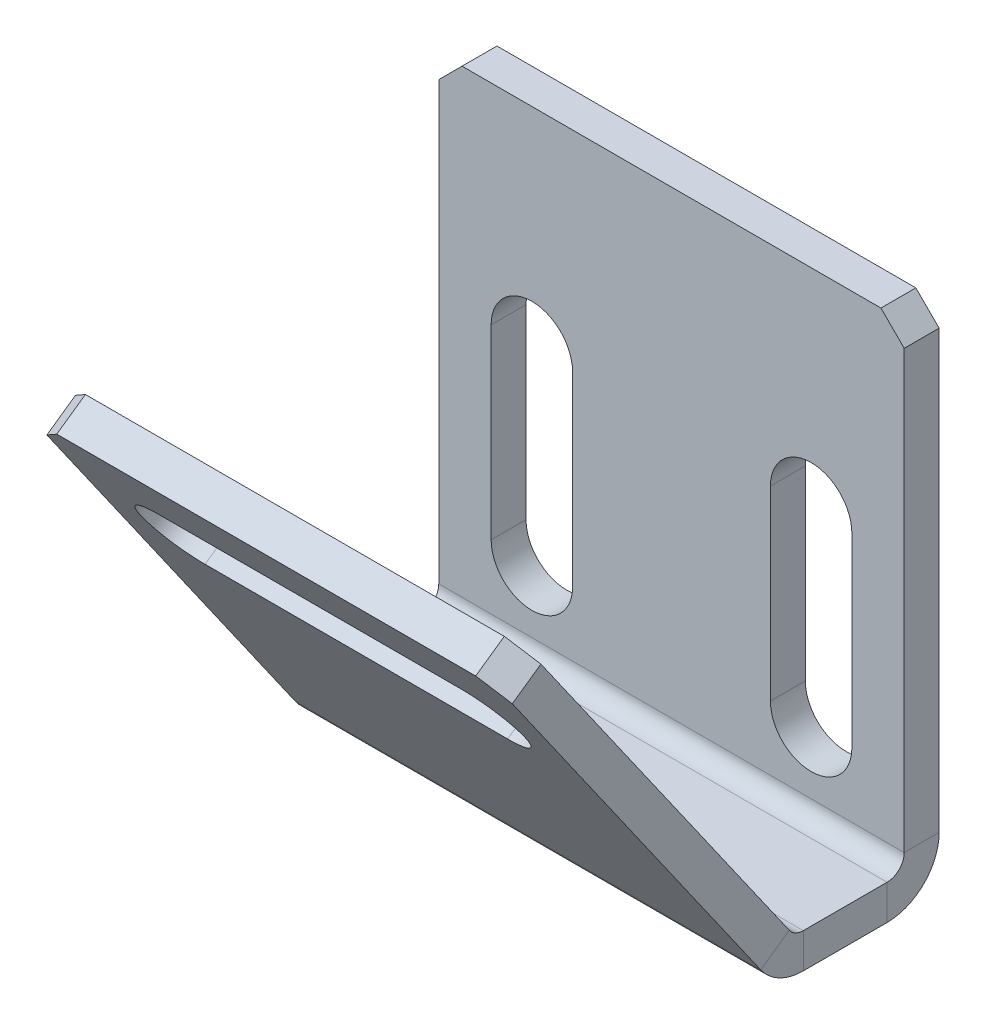
from build123d import *

# Parameters (mm, degrees)
SKETCH1_W                    = 20
SKETCH1_H                    = 22
BASE_FLANGE1_DEPTH           = 1.5
EDGE_FLANGE1_STRIP_W         = 7.4732
EDGE_FLANGE1_STRIP_H         = 1.5
EDGE_FLANGE1_STRIP_CUT_DEPTH = 20
EDGE_FLANGE1_DEPTH           = 20
EDGE_FLANGE2_START           = -8.98015873
EDGE_FLANGE2_DEPTH           = 20
EDGE_FLANGE2_2_DEPTH         = 20
CUT_EXTRUDE1_DEPTH           = 10
CHAMFER1_SIZE                = 1
CHAMFER2_SIZE                = 1


# Read off the part's stored shape, not the designer's step: Edge-Flange2
# Sheet-metal steps are written as plain solids
with BuildPart() as part:
    # Sketch1 → Base-Flange1 (new body)
    with BuildSketch(Plane.XY):
        with Locations((1.01984127, -10.920634921)):
            Rectangle(SKETCH1_W, SKETCH1_H)
        with BuildLine():
            Line((-6.73015873, -8.920634921), (-6.73015873, -16.920634921))
            ThreePointArc((-6.73015873, -16.920634921), (-4.98015873, -18.670634921), (-3.23015873, -16.920634921))
            Line((-3.23015873, -16.920634921), (-3.23015873, -8.920634921))
            ThreePointArc((-3.23015873, -8.920634921), (-4.98015873, -7.170634921), (-6.73015873, -8.920634921))
        make_face(mode=Mode.SUBTRACT)
        with BuildLine():
            Line((5.26984127, -8.920634921), (5.26984127, -16.920634921))
            ThreePointArc((5.26984127, -16.920634921), (7.01984127, -18.670634921), (8.76984127, -16.920634921))
            Line((8.76984127, -16.920634921), (8.76984127, -8.920634921))
            ThreePointArc((8.76984127, -8.920634921), (7.01984127, -7.170634921), (5.26984127, -8.920634921))
        make_face(mode=Mode.SUBTRACT)
    extrude(amount=-BASE_FLANGE1_DEPTH)

    # Edge-Flange1 strip (across the edge) → Edge-Flange1 strip cut (cut)
    with BuildSketch(Plane(origin=(-8.98015873, -21.920634921, 0), x_dir=(0, 1, 0), z_dir=(1, 0, 0))):
        with Locations((-1.5, -0.75)):
            Rectangle(EDGE_FLANGE1_STRIP_W, EDGE_FLANGE1_STRIP_H)
    extrude(amount=EDGE_FLANGE1_STRIP_CUT_DEPTH, mode=Mode.SUBTRACT)

    # Edge-Flange1 section (across the edge) → Edge-Flange1 (add)
    with BuildSketch(Plane(origin=(-8.98015873, -21.920634921, 0), x_dir=(0, 1, 0), z_dir=(1, 0, 0))):
        with BuildLine():
            Line((0, 0.7366), (0, 6.55))
            Line((0, 6.55), (1.5, 6.55))
            Line((1.5, 6.55), (1.5, 0.7366))
            ThreePointArc((1.5, 0.7366), (1.715745145, 0.215745145), (2.2366, 0))
            Line((2.2366, 0), (2.2366, -1.5))
            ThreePointArc((2.2366, -1.5), (0.655084973, -0.844915027), (0, 0.7366))
        make_face()
    extrude(amount=EDGE_FLANGE1_DEPTH)

    # Edge-Flange2 outline → Edge-Flange2 (cut)
    with BuildSketch(Plane.YZ.offset(EDGE_FLANGE2_START)):
        with BuildLine():
            ThreePointArc((-21.920634921, 4.335388427), (-21.66792335, 5.368135376), (-20.966895978, 6.16750389))
            Line((-20.966895978, 6.16750389), (-20.420634921, 6.55))
            Line((-20.420634921, 6.55), (-21.920634921, 6.55))
            Line((-21.920634921, 6.55), (-21.920634921, 4.335388427))
        make_face()
    extrude(amount=EDGE_FLANGE2_DEPTH, mode=Mode.SUBTRACT)

    # Edge-Flange2 2 outline → Edge-Flange2 2 (add)
    with BuildSketch(Plane.YZ.offset(EDGE_FLANGE2_START)):
        with BuildLine():
            Line((-4.906846961, 17.412871276), (-20.420634921, 6.55))
            Line((-20.420634921, 6.55), (-20.420634921, 4.335388427))
            ThreePointArc((-20.420634921, 4.335388427), (-20.3374071, 4.675512455), (-20.106531324, 4.938775823))
            Line((-20.106531324, 4.938775823), (-4.046482306, 16.184143209))
            Line((-4.046482306, 16.184143209), (-4.906846961, 17.412871276))
        make_face()
    extrude(amount=EDGE_FLANGE2_2_DEPTH)

    # Sketch12 → Cut-Extrude1 (cut)
    with BuildSketch(Plane(origin=(0, -9.795676552, 13.989675943), x_dir=(1, 0, 0), z_dir=(0, -0.5735764363510533, 0.8191520442889869))):
        with BuildLine():
            Line((7.51984127, -0.781841066), (-5.48015873, -0.781841066))
            ThreePointArc((-5.48015873, -0.781841066), (-7.23015873, 0.968158934), (-5.48015873, 2.718158934))
            Line((-5.48015873, 2.718158934), (7.51984127, 2.718158934))
            ThreePointArc((7.51984127, 2.718158934), (9.26984127, 0.968158934), (7.51984127, -0.781841066))
        make_face()
    extrude(amount=-CUT_EXTRUDE1_DEPTH, mode=Mode.SUBTRACT)

    # Chamfer1
    chamfer1_edges = [part.edges().sort_by_distance(p)[0] for p in [
        (11.01984127, 0.079365079, -0.75),
    ]]
    chamfer(chamfer1_edges, length=CHAMFER1_SIZE)

    # Chamfer2
    chamfer2_edges = [part.edges().sort_by_distance(p)[0] for p in [
        (-8.98015873, 0.079365079, -0.75),
        (-8.98015873, -4.476664634, 16.798507243),
        (11.01984127, -4.476664634, 16.798507243),
    ]]
    chamfer(chamfer2_edges, length=CHAMFER2_SIZE)


solid = part.part
